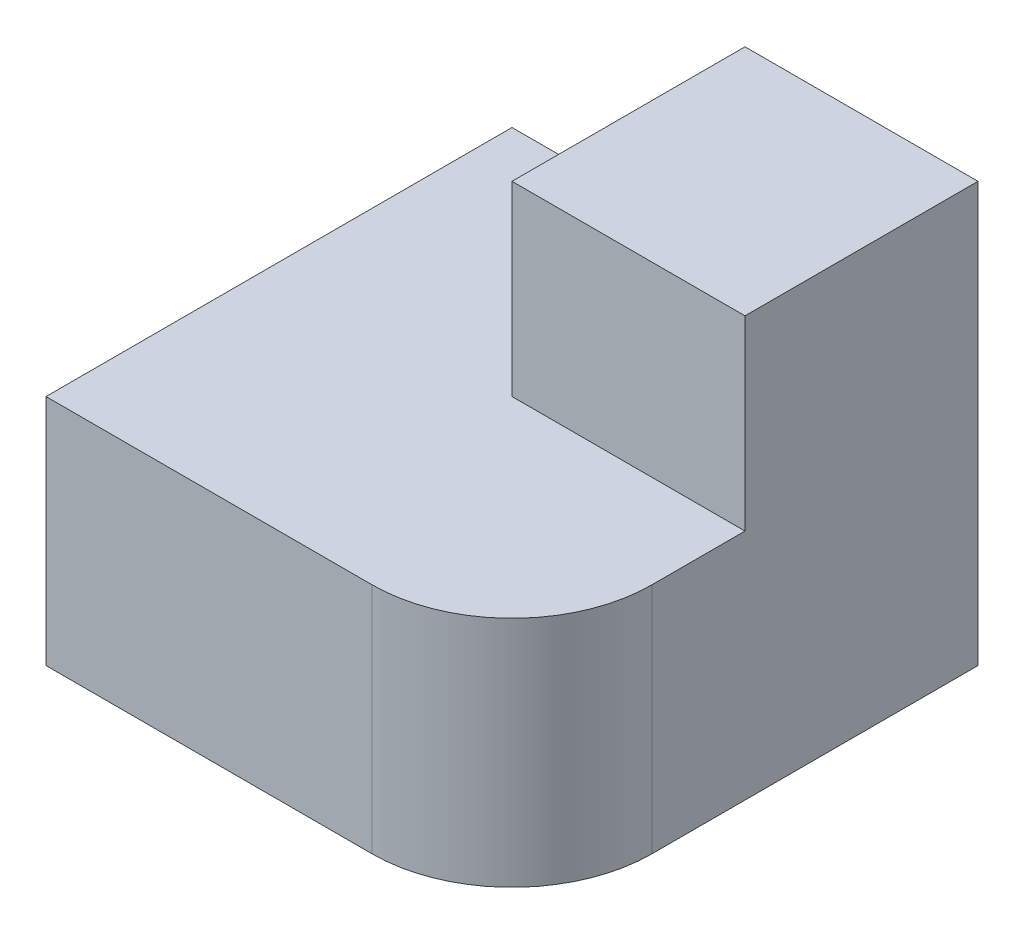
from build123d import *

# Parameters (mm, degrees)
SKETCH1_W           = 10
SKETCH1_H           = 10
BOSS_EXTRUDE1_DEPTH = 5
SKETCH2_W           = 5
SKETCH2_H           = 5
BOSS_EXTRUDE2_DEPTH = 4
FILLET2_R           = 3


with BuildPart() as part:
    # Sketch1 → Boss-Extrude1 (new body)
    with BuildSketch(Plane(origin=(0, 0, 0), x_dir=(1, 0, 0), z_dir=(0, 1, 0))):
        Rectangle(SKETCH1_W, SKETCH1_H)
    extrude(amount=BOSS_EXTRUDE1_DEPTH)

    # Sketch2 → Boss-Extrude2 (add)
    with BuildSketch(Plane(origin=(0, 5, 0), x_dir=(1, 0, 0), z_dir=(0, 1, 0))):
        with Locations((2.5, 2.5)):
            Rectangle(SKETCH2_W, SKETCH2_H)
    extrude(amount=BOSS_EXTRUDE2_DEPTH)

    # Fillet2
    fillet2_edges = [part.edges().sort_by_distance(p)[0] for p in [
        (5, 2.5, 5),
    ]]
    fillet(fillet2_edges, radius=FILLET2_R)


solid = part.part
